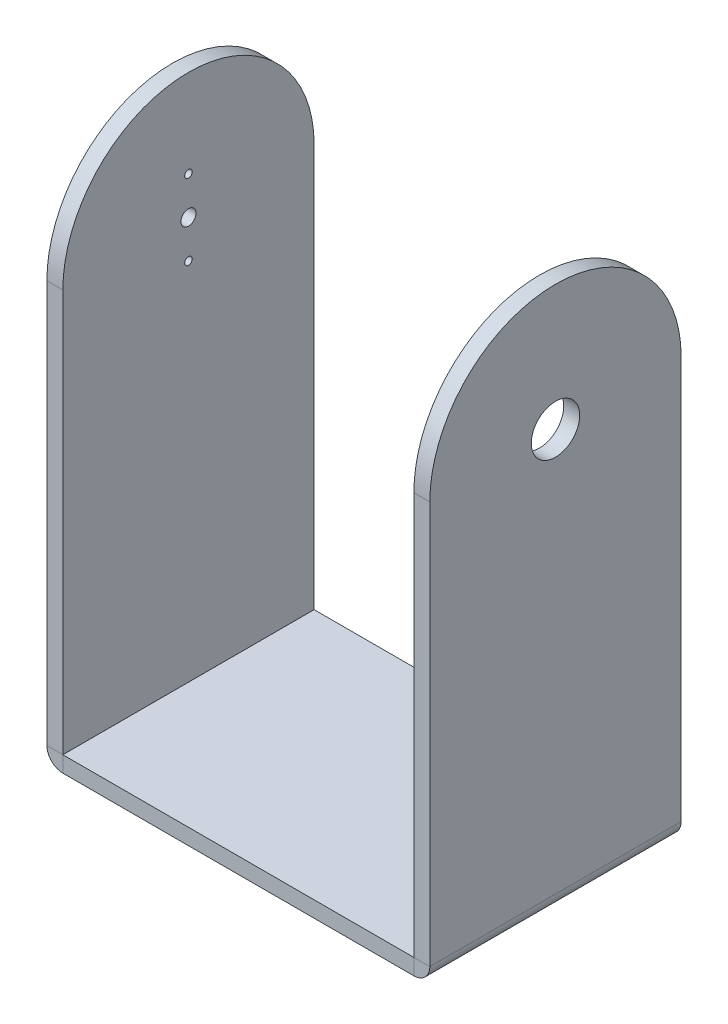
from build123d import *

# Parameters (mm, degrees)
SKETCH1_W              = 300
SKETCH1_H              = 50
BASE_FLANGE1_DEPTH     = 3.175
SKETCHED_BEND2_DEPTH   = 50
SKETCHED_BEND2_2_DEPTH = 50
SKETCH7_R              = 4.815
CUT_EXTRUDE1_DEPTH     = 10
SKETCH8_R              = 1.5
SKETCH8_R_2            = 0.75
CUT_EXTRUDE2_DEPTH     = 10
CUT_EXTRUDE3_DEPTH     = 140.094007146


# Read off the part's stored shape, not the designer's step: Sketched Bend2
# Sheet-metal steps are written as plain solids
with BuildPart() as part:
    # Sketch1 → Base-Flange1 (new body)
    with BuildSketch(Plane(origin=(0, 0, 0), x_dir=(1, 0, 0), z_dir=(0, 1, 0))):
        with Locations((0, -25)):
            Rectangle(SKETCH1_W, SKETCH1_H)
    extrude(amount=-BASE_FLANGE1_DEPTH)

    # Sketched Bend2 outline → Sketched Bend2 (cut)
    with BuildSketch(Plane.XY):
        with BuildLine():
            Line((-150, -3.175), (-34.919, -3.175))
            ThreePointArc((-34.919, -3.175), (-37.164417556, -2.245124663), (-38.094999843, 0))
            Line((-38.094999843, 0), (-150, 0))
            Line((-150, 0), (-150, -3.175))
        make_face()
        with BuildLine():
            ThreePointArc((38.094999843, 0), (37.164417556, -2.245124663), (34.919, -3.175))
            Line((34.919, -3.175), (150, -3.175))
            Line((150, -3.175), (150, 0))
            Line((150, 0), (38.094999843, 0))
        make_face()
    extrude(amount=SKETCHED_BEND2_DEPTH, mode=Mode.SUBTRACT)

    # Sketched Bend2 2 outline → Sketched Bend2 2 (add)
    with BuildSketch(Plane.XY):
        with BuildLine():
            ThreePointArc((-38.095, 0.001), (-38.094999961, 0.0005), (-38.094999843, 0))
            Line((-38.094999843, 0), (-34.919, 0))
            ThreePointArc((-34.919, 0), (-34.919707107, 0.000292893), (-34.92, 0.001))
            Line((-34.92, 0.001), (-34.92, 105.082))
            Line((-34.92, 105.082), (-38.095, 105.082))
            Line((-38.095, 105.082), (-38.095, 0.001))
        make_face()
        with BuildLine():
            Line((34.919, 0), (38.094999843, 0))
            ThreePointArc((38.094999843, 0), (38.094999961, 0.0005), (38.095, 0.001))
            Line((38.095, 0.001), (38.095, 105.082))
            Line((38.095, 105.082), (34.92, 105.082))
            Line((34.92, 105.082), (34.92, 0.001))
            ThreePointArc((34.92, 0.001), (34.919707107, 0.000292893), (34.919, 0))
        make_face()
    extrude(amount=SKETCHED_BEND2_2_DEPTH)

    # Sketch7 → Cut-Extrude1 (cut)
    with BuildSketch(Plane(origin=(38.095, 0, 0), x_dir=(0, 0, -1), z_dir=(1, 0, 0))):
        with Locations(Location((-25, 80.082, 0), (0, 0, 90))):
            Circle(SKETCH7_R)
    extrude(amount=-CUT_EXTRUDE1_DEPTH, mode=Mode.SUBTRACT)

    # Sketch8 → Cut-Extrude2 (cut)
    with BuildSketch(Plane.ZY.offset(38.095)):
        with Locations(Location((25, 80.082, 0), (0, 0, 270))):
            Circle(SKETCH8_R)
        with Locations(Location((25, 87.582, 0), (0, 0, 270))):
            Circle(SKETCH8_R_2)
        with Locations(Location((25, 72.582, 0), (0, 0, 270))):
            Circle(SKETCH8_R_2)
    extrude(amount=-CUT_EXTRUDE2_DEPTH, mode=Mode.SUBTRACT)

    # Sketch9 → Cut-Extrude3 (cut, through all)
    with BuildSketch(Plane.ZY.offset(38.095)):
        with BuildLine():
            Line((0, 105.082), (0, 80.082))
            ThreePointArc((0, 80.082), (7.32233047, 97.75966953), (25, 105.082))
            Line((25, 105.082), (0, 105.082))
        make_face()
        with BuildLine():
            ThreePointArc((25, 105.082), (42.67766953, 97.75966953), (50, 80.082))
            Line((50, 80.082), (50, 105.082))
            Line((50, 105.082), (25, 105.082))
        make_face()
    extrude(amount=-CUT_EXTRUDE3_DEPTH, mode=Mode.SUBTRACT)


solid = part.part
